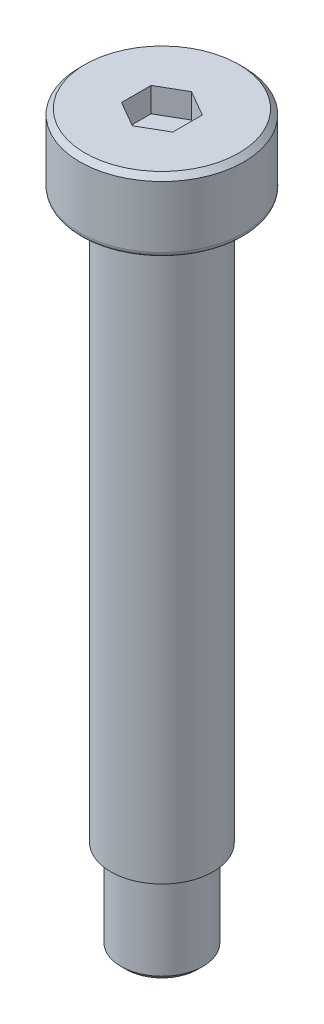
from build123d import *

# Parameters (mm, degrees)
CUT_EXTRUDE1_DEPTH = 2.4
CHAMFER1_SIZE      = 0.5
FILLET1_R          = 0.5
CHAMFER2_SIZE      = 0.5


with BuildPart() as part:
    # Sketch1 → Revolve1 (revolve)
    with BuildSketch(Plane.XY):
        Polygon((0, 0), (8, 0), (8, -7), (4.75, -7), (4.75, -7.5), (5, -7.5), (5, -62), (4, -62), (4, -71), (0, -71), align=None)
    revolve(axis=Axis((0, 5, 0), (0, -1, 0)))

    # Sketch2 → Cut-Extrude1 (cut)
    with BuildSketch(Plane(origin=(0, 0, 0), x_dir=(1, 0, 0), z_dir=(0, 1, 0))):
        Polygon((0, -2.886751346), (2.5, -1.443375673), (2.5, 1.443375673), (0, 2.886751346), (-2.5, 1.443375673), (-2.5, -1.443375673), align=None)
    extrude(amount=-CUT_EXTRUDE1_DEPTH, mode=Mode.SUBTRACT)

    # Chamfer1
    chamfer1_edges = [part.edges().sort_by_distance(p)[0] for p in [
        (-8, 0, 0),
    ]]
    chamfer(chamfer1_edges, length=CHAMFER1_SIZE)

    # Fillet1
    fillet1_edges = [part.edges().sort_by_distance(p)[0] for p in [
        (-8, -7, 0),
    ]]
    fillet(fillet1_edges, radius=FILLET1_R)

    # Chamfer2
    chamfer2_edges = [part.edges().sort_by_distance(p)[0] for p in [
        (-4, -71, 0),
    ]]
    chamfer(chamfer2_edges, length=CHAMFER2_SIZE)


solid = part.part
